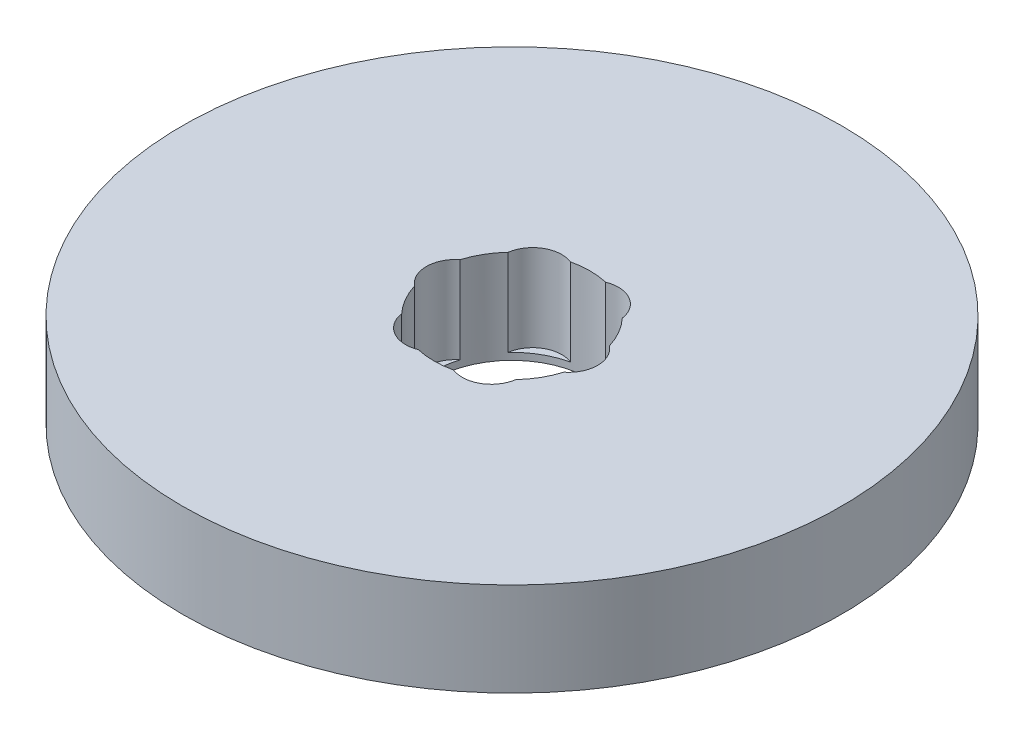
from build123d import *

# Parameters (mm, degrees)
SKETCH1_R           = 95
BOSS_EXTRUDE1_DEPTH = 27
SKETCH2_R           = 22.5
CUT_EXTRUDE1_DEPTH  = 138.03649149
SKETCH3_R           = 8.386818152
CUT_EXTRUDE2_DEPTH  = 24.99466896
CIRPATTERN1_COUNT   = 6


with BuildPart() as part:
    # Sketch1 → Boss-Extrude1 (new body)
    with BuildSketch(Plane(origin=(0, 0, 0), x_dir=(1, 0, 0), z_dir=(0, 1, 0))):
        Circle(SKETCH1_R)
    extrude(amount=BOSS_EXTRUDE1_DEPTH)

    # Sketch2 → Cut-Extrude1 (cut, through all)
    with BuildSketch(Plane(origin=(0, 0, 0), x_dir=(1, 0, 0), z_dir=(0, 1, 0))):
        Circle(SKETCH2_R)
    extrude(amount=CUT_EXTRUDE1_DEPTH, mode=Mode.SUBTRACT)

    # Sketch3 → Cut-Extrude2 (cut)
    with BuildSketch(Plane(origin=(0, 27, 0), x_dir=(1, 0, 0), z_dir=(0, 1, 0))):
        with Locations((-16.30909516, 0)):
            Circle(SKETCH3_R)
    cut_extrude2 = extrude(amount=-CUT_EXTRUDE2_DEPTH, mode=Mode.SUBTRACT)

    # CirPattern1: Cut-Extrude2 ×6 about axis
    cirpattern1_axis = Axis((0, 0, 0), (0, 1, 0))
    for i in range(1, CIRPATTERN1_COUNT):
        add(cut_extrude2.rotate(cirpattern1_axis, i * 360 / CIRPATTERN1_COUNT), mode=Mode.SUBTRACT)


solid = part.part
